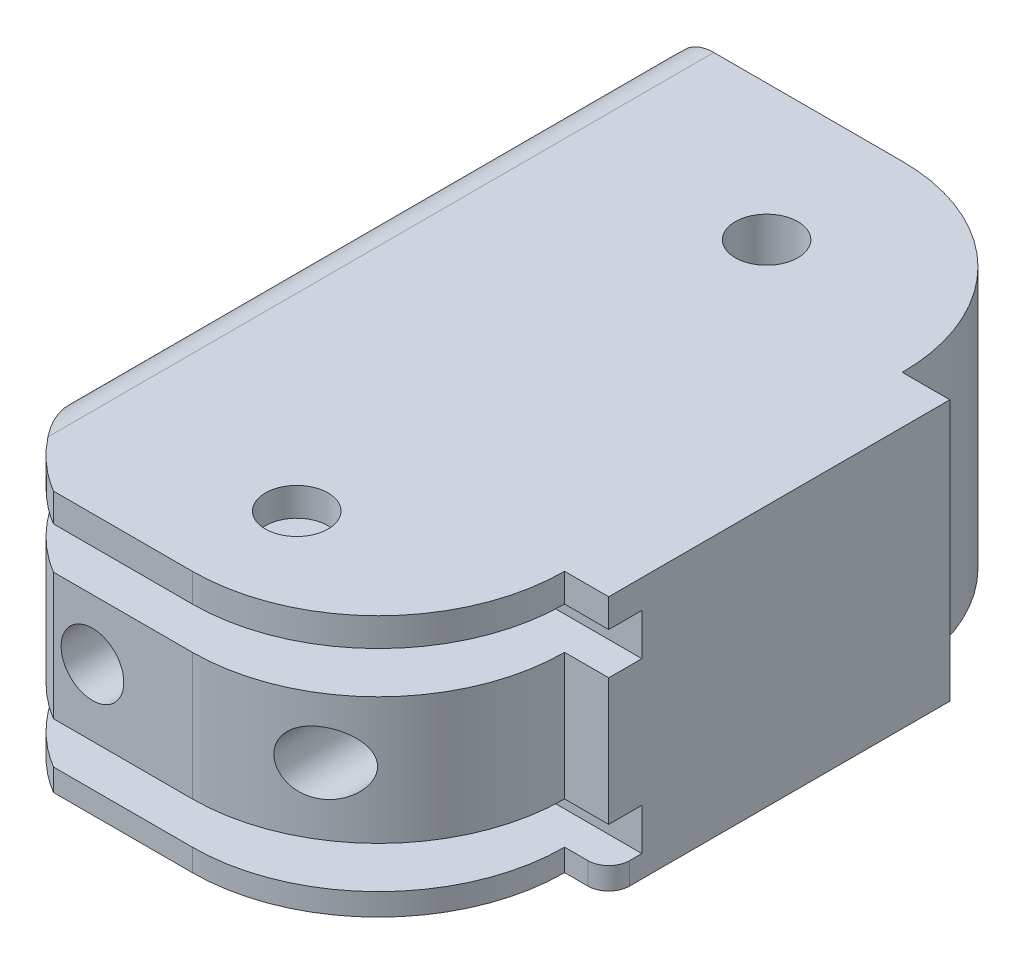
from build123d import *

# Parameters (mm, degrees)
SKETCH1_W               = 22.054431489
SKETCH1_H               = 12.5
BOSS_EXTRUDE1_DEPTH     = 34
CUT_EXTRUDE1_DEPTH      = 10
CUT_EXTRUDE1_DEPTH_BACK = 15
SKETCH2_R               = 1.5
FILLET3_R               = 2
SKETCH5_R               = 1.5
CUT_EXTRUDE4_DEPTH      = 52.610795679
SKETCH16_W              = 22.05443149
SKETCH16_H              = 2
CUT_EXTRUDE6_DEPTH      = 14.5
FILLET4_R               = 1


with BuildPart() as part:
    # Sketch1 → Boss-Extrude1 (new body)
    with BuildSketch(Plane.XY):
        with Locations((-13.228930986, -24.070183414)):
            Rectangle(SKETCH1_W, SKETCH1_H)
    extrude(amount=BOSS_EXTRUDE1_DEPTH)

    # Sketch2 → Cut-Extrude1 (cut, two sides: drawn at the far end of the back side and taken through both)
    with BuildSketch(Plane.XZ.offset(30.320183414).offset(-CUT_EXTRUDE1_DEPTH_BACK)):
        with Locations(Location((-13.228930986, 6.5, 0), (0, 0, 90))):
            Circle(SKETCH2_R)
        with Locations(Location((-13.228930986, 29, 0), (0, 0, 90))):
            Circle(SKETCH2_R)
        with BuildLine():
            Line((-4.315096089, 25.086165103), (-2.201715242, 25.086165103))
            add(Edge.make_bspline(
                [(-24.256146731, 25.458595261), (-35.656041951, 36.540332573), (-13.006901701, 52.285060009), (9.32231541, 36.338450422), (-2.201715242, 25.086165103)],
                knots=[0, 0, 0, 0, 0.496841919, 1, 1, 1, 1], degree=3))
            add(Edge.make_bspline(
                [(-13.228930986, 34), (-19.086447972, 37.422293362), (-24.885707195, 30.868976401), (-24.256146731, 25.458595261)],
                knots=[0, 0, 0, 0, 1, 1, 1, 1], degree=3))
            ThreePointArc((-13.228930986, 34), (-6.925897884, 31.389198205), (-4.315096089, 25.086165103))
        make_face()
        with BuildLine():
            Line((-4.478930986, 8.75), (-2.201715242, 8.75))
            add(Edge.make_bspline(
                [(-2.201715242, 8.75), (5.39210746, 3.880294823), (-0.777052631, -4.523329032), (-17.174300591, -10.623347238), (-34.821400648, -0.026005424), (-24.256146731, 8.75)],
                knots=[0, 0, 0, 0, 0.283272691, 0.504244858, 1, 1, 1, 1], degree=3))
            add(Edge.make_bspline(
                [(-23.490579314, 0), (-24.966512963, 4.237786421), (-24.256146731, 8.75)],
                knots=[0, 0, 0, 1, 1, 1], degree=2))
            Line((-23.490579314, 0), (-13.228930986, 0))
            ThreePointArc((-13.228930986, 0), (-7.041746651, 2.562815665), (-4.478930986, 8.75))
        make_face()
    extrude(amount=CUT_EXTRUDE1_DEPTH + CUT_EXTRUDE1_DEPTH_BACK, mode=Mode.SUBTRACT)

    # Fillet3
    # the kernel refuses this fillet: 2 mm, written as the material it takes off along each edge
    with BuildSketch(Plane(origin=(-24.256146731, -17.820183414, -1.998495188), x_dir=(1, 0, 0), z_dir=(0, 0, 1))) as fillet3_piece_1:
        with BuildLine():
            CenterArc((FILLET3_R, -FILLET3_R), FILLET3_R, 90, 90)
            Line((0, -FILLET3_R), (0, 0))
            Line((0, 0), (FILLET3_R, 0))
        make_face()
    extrude(amount=34.125242274, mode=Mode.SUBTRACT)
    with BuildSketch(Plane(origin=(-24.256146731, -30.320183414, -1.998495188), x_dir=(1, 0, 0), z_dir=(0, 0, 1))) as fillet3_piece_2:
        with BuildLine():
            CenterArc((FILLET3_R, FILLET3_R), FILLET3_R, 180, 90)
            Line((0, FILLET3_R), (0, 0))
            Line((0, 0), (FILLET3_R, 0))
        make_face()
    extrude(amount=34.125242274, mode=Mode.SUBTRACT)
    with BuildSketch(Plane(origin=(-24.256146731, -17.374523396, 3.001504812), x_dir=(0.1667681859257429, 1.4874647964432132e-15, -0.9859961319209304), z_dir=(0, -1, 0))) as fillet3_piece_3:
        with BuildLine():
            CenterArc((0.168096911, 1.999974157), FILLET3_R, 260.400032587, 9.891234523)
            Line((-0.165439461, 0.027981894), (0, 0))
            ThreePointArc((0, 0), (0.089132004, -0.000226606), (0.178264007, 0))
        make_face()
    extrude(amount=13.331280444, mode=Mode.SUBTRACT)
    with BuildSketch(Plane(origin=(-24.256146731, -17.482274803, 27.126747086), x_dir=(0.11756979569322837, -1.02728794699617e-15, 0.9930646218351818), z_dir=(0, -1, 0))) as fillet3_piece_4:
        with BuildLine():
            CenterArc((0.118560979, -1.999931088), FILLET3_R, 89.524368939, 7.227500304)
            Line((-0.116578613, -0.013801845), (0, 0))
            ThreePointArc((0, 0), (0.067581725, 0.000281106), (0.135163444, 0))
        make_face()
    extrude(amount=13.131401648, mode=Mode.SUBTRACT)

    # Sketch5 → Cut-Extrude4 (cut, through all)
    with BuildSketch(Plane.XY):
        with Locations((-18.011106811, -24.070183414)):
            Circle(SKETCH5_R)
        with Locations(Location((-8.446755162, -24.070183414, 0), (0, 0, 180))):
            Circle(SKETCH5_R)
    extrude(amount=CUT_EXTRUDE4_DEPTH, mode=Mode.SUBTRACT)

    # Sketch16 → Cut-Extrude6 (cut)
    with BuildSketch(Plane.XY.offset(38)):
        with Locations((-13.228930985, -20.1809771)):
            Rectangle(SKETCH16_W, SKETCH16_H)
        with Locations((-13.228930985, -28.261916897)):
            Rectangle(SKETCH16_W, SKETCH16_H)
    extrude(amount=-CUT_EXTRUDE6_DEPTH, mode=Mode.SUBTRACT)

    # Fillet4
    fillet4_edges = [part.edges().sort_by_distance(p)[0] for p in [
        (-2.201715242, -29.791050155, 25.086165103),
    ]]
    fillet(fillet4_edges, radius=FILLET4_R)


solid = part.part
